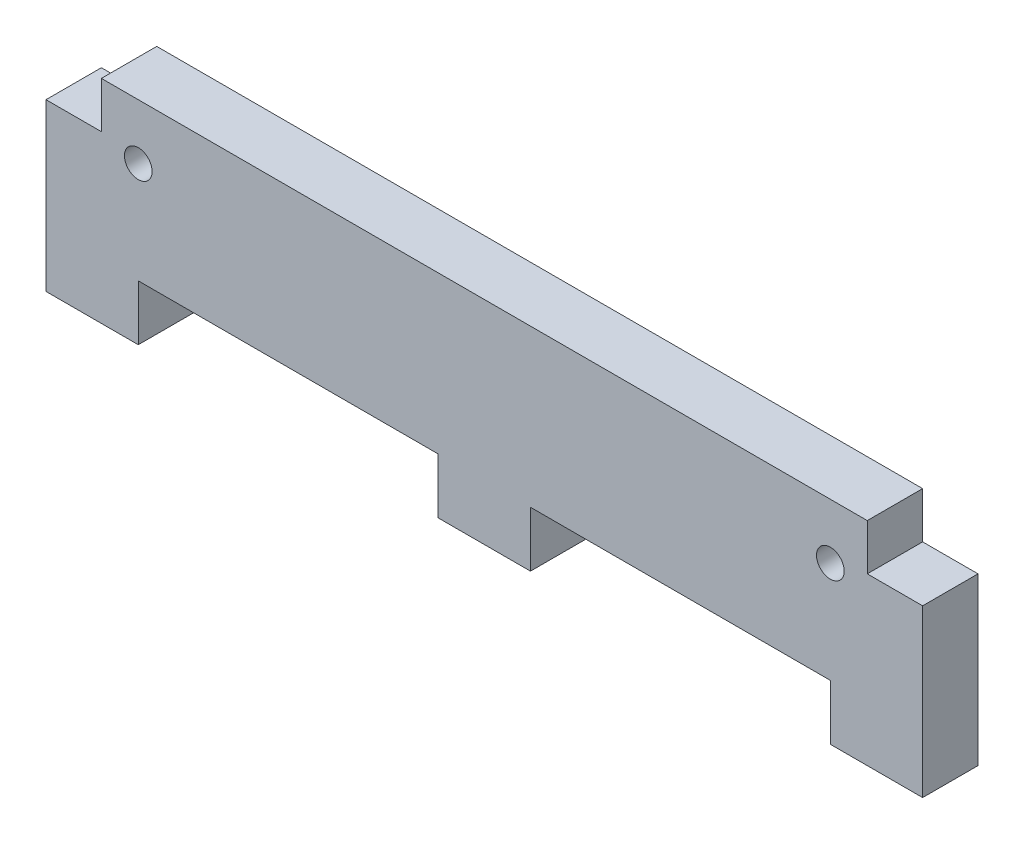
from build123d import *

# Parameters (mm, degrees)
SKETCH1_W           = 95
SKETCH1_H           = 23
BOSS_EXTRUDE1_DEPTH = 6
SKETCH2_W           = 32.5
SKETCH2_H           = 6
CUT_EXTRUDE1_DEPTH  = 98.928545379
SKETCH4_R           = 1.5
CUT_EXTRUDE2_DEPTH  = 98.928545379
SKETCH5_W           = 6
SKETCH5_H           = 5
CUT_EXTRUDE3_DEPTH  = 98.928545379


with BuildPart() as part:
    # Sketch1 → Boss-Extrude1 (new body)
    with BuildSketch(Plane.XY):
        with Locations((47.5, 11.5)):
            Rectangle(SKETCH1_W, SKETCH1_H)
    extrude(amount=BOSS_EXTRUDE1_DEPTH)

    # Sketch2 → Cut-Extrude1 (cut, through all)
    with BuildSketch(Plane.XY.offset(6)):
        with Locations((26.25, 3)):
            Rectangle(SKETCH2_W, SKETCH2_H)
        with Locations((68.75, 3)):
            Rectangle(SKETCH2_W, SKETCH2_H)
    extrude(amount=-CUT_EXTRUDE1_DEPTH, mode=Mode.SUBTRACT)

    # Sketch4 → Cut-Extrude2 (cut, through all)
    with BuildSketch(Plane.XY.offset(6)):
        with Locations((10, 17)):
            Circle(SKETCH4_R)
        with Locations((85, 17)):
            Circle(SKETCH4_R)
    extrude(amount=-CUT_EXTRUDE2_DEPTH, mode=Mode.SUBTRACT)

    # Sketch5 → Cut-Extrude3 (cut, through all)
    with BuildSketch(Plane.XY.offset(6)):
        with Locations((3, 20.5)):
            Rectangle(SKETCH5_W, SKETCH5_H)
        with Locations((92, 20.5)):
            Rectangle(SKETCH5_W, SKETCH5_H)
    extrude(amount=-CUT_EXTRUDE3_DEPTH, mode=Mode.SUBTRACT)


solid = part.part
